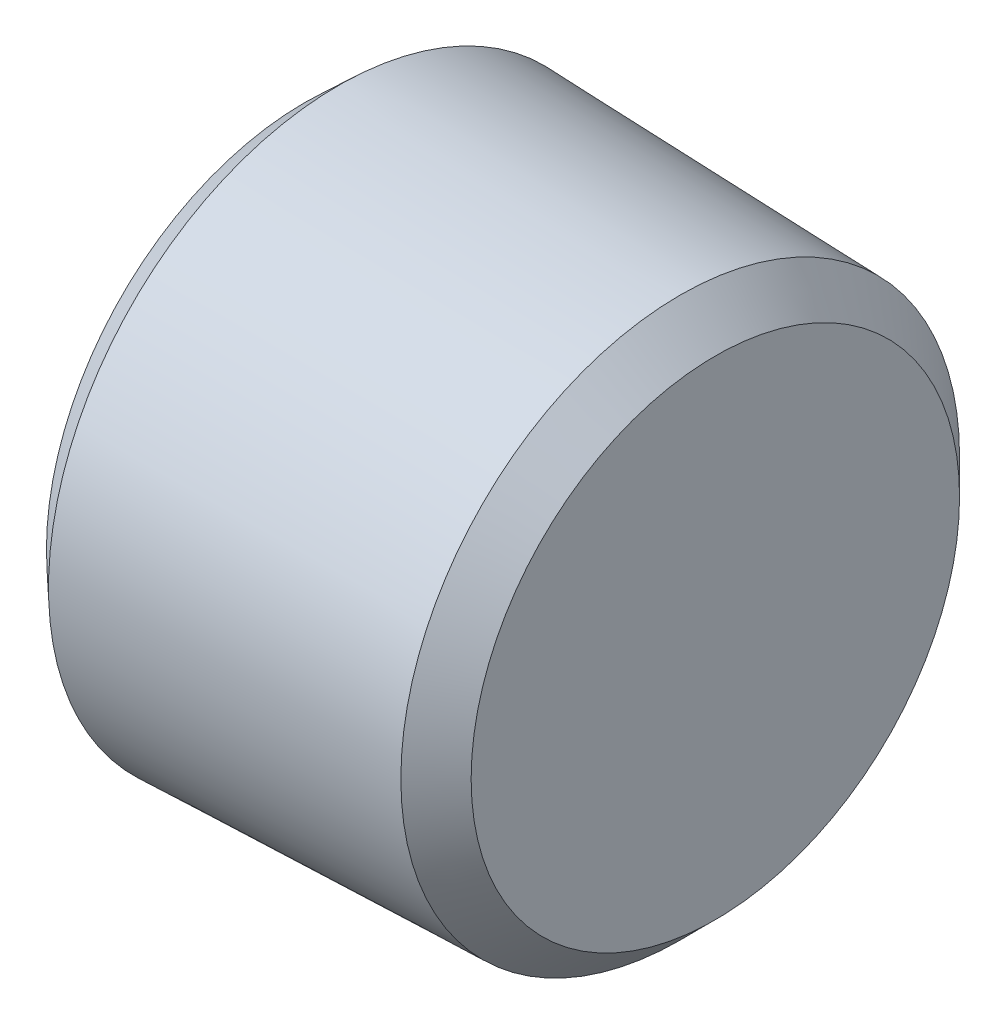
from build123d import *

# Parameters (mm, degrees)
HEX_2_DEPTH = 2


with BuildPart() as part:
    # Threads_Sketch → Threads (revolve)
    with BuildSketch(Plane.XY, mode=Mode.PRIVATE) as threads_sk:
        Polygon((0, 0), (0, 4.958321687), (7, 4.740416799), (7, 0), align=None)
    revolve(threads_sk.sketch.rotate(Axis((-5.91867895, 0, 0), (1, 0, 0)), 90), axis=Axis((-5.91867895, 0, 0), (1, 0, 0)))

    # Threads Cham: read off the stored shape, not the designer's step
    # Threads Cham outline → Threads Cham (revolve, cut)
    with BuildSketch(Plane.YX):
        Polygon((4.160416799, 7), (4.759051872, 6.401364927), (4.759051872, 7), align=None)
        Polygon((4.940275453, 0), (4.940275453, 0.579719185), (4.395559124, 0), align=None)
    revolve(axis=Axis((0, 0, 0), (1, 0, 0)), mode=Mode.SUBTRACT)

    # Threads Cham 2 outline → Threads Cham 2 (revolve, cut)
    with BuildSketch(Plane.YX):
        Polygon((4.940275453, 0.579719185), (4.940275453, 0), (4.958321687, 0), align=None)
    revolve(axis=Axis((0, 0, 0), (1, 0, 0)), mode=Mode.SUBTRACT)

    # Hex_Sketch → Hex 2 (cut)
    with BuildSketch(Plane.ZY):
        Polygon((2.748187281, 0), (1.374093641, 2.38), (-1.374093641, 2.38), (-2.748187281, 0), (-1.374093641, -2.38), (1.374093641, -2.38), align=None)
    extrude(amount=-HEX_2_DEPTH, mode=Mode.SUBTRACT)


solid = part.part
